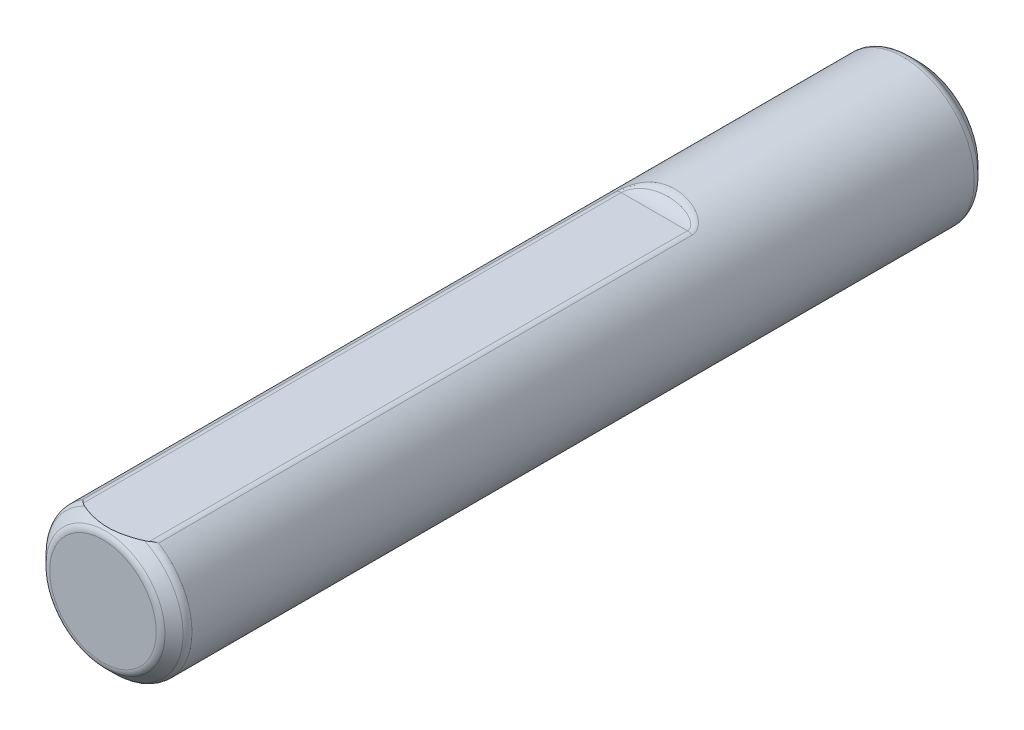
from build123d import *

# Parameters (mm, degrees)
SKETCH1_R      = 3.175
EXTRUDE1_DEPTH = 18.25625
CHAMFER1_SIZE  = 0.635
EXTRUDE7_DEPTH = 26.793821935
FILLET1_R      = 0.79375
FILLET3_R      = 0.396875


with BuildPart() as part:
    # Sketch1 → Extrude1 (new, symmetric)
    with BuildSketch(Plane.XY):
        Circle(SKETCH1_R)
    extrude(amount=EXTRUDE1_DEPTH, both=True)

    # Chamfer1
    chamfer1_edges = [part.edges().sort_by_distance(p)[0] for p in [
        (-3.175, 0, -18.25625),
        (-3.175, 0, 18.25625),
    ]]
    chamfer(chamfer1_edges, length=CHAMFER1_SIZE)

    # Sketch13 → Extrude7 (cut, through all)
    with BuildSketch(Plane.XY.offset(-7.14375)):
        with BuildLine():
            Line((-1.5875, 2.749630657), (1.5875, 2.749630657))
            ThreePointArc((1.5875, 2.749630657), (0, 3.175), (-1.5875, 2.749630657))
        make_face()
    extrude(amount=EXTRUDE7_DEPTH, mode=Mode.SUBTRACT)

    # Fillet1
    # the kernel refuses this fillet: 0.79375 mm, written as the material it adds along each edge
    with BuildSketch(Plane(origin=(-3.571875, 2.749630657, -7.14375), x_dir=(0, 0, 1), z_dir=(1, 0, 0))) as fillet1_piece_1_section:
        with BuildLine():
            CenterArc((FILLET1_R, -FILLET1_R), FILLET1_R, 90, 90)
            Line((0, -FILLET1_R), (0, 0))
            Line((0, 0), (FILLET1_R, 0))
        make_face()
    fillet1_piece_1 = extrude(amount=7.14375, mode=Mode.PRIVATE)
    fillet1_piece_1 = fillet1_piece_1 & Plane(origin=(0, 0, -6.922980594), x_dir=(1, 0, 0), z_dir=(0, 0, 1)) * Cylinder(3.175, 18, mode=Mode.PRIVATE)
    add(fillet1_piece_1)

    # Fillet3
    fillet3_edges = [part.edges().sort_by_distance(p)[0] for p in [
        (1.5875, 2.749630657, 5.635625),
        (-1.5875, 2.749630657, 5.635625),
        (0, 3.175, -7.053089435),
        (-2.54, 0, -18.25625),
        (-3.175, 0, -17.62125),
        (-2.54, 0, 18.25625),
        (-1.5875, -2.749630657, 17.62125),
    ]]
    fillet(fillet3_edges, radius=FILLET3_R)


solid = part.part
